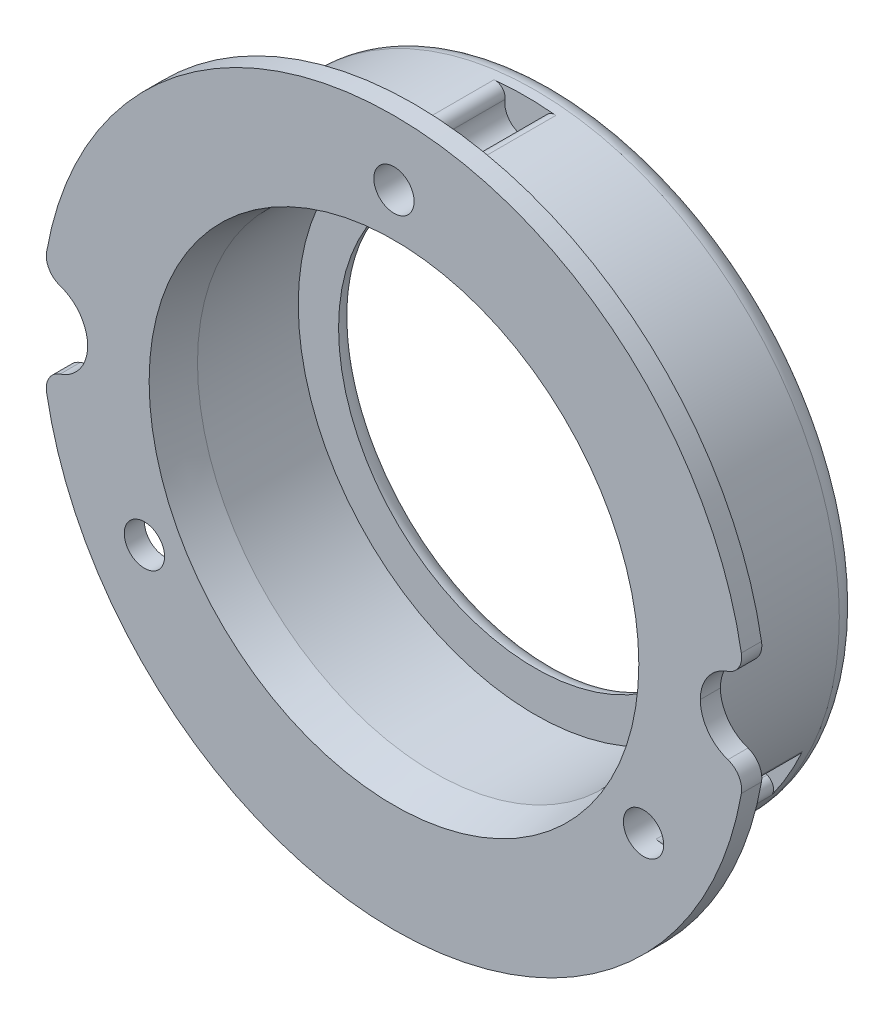
from build123d import *

# Parameters (mm, degrees)
SKETCH_1_R               = 15.1
SKETCH_1_R_2             = 11.750000000000002
EXTRUDE_1_DEPTH          = 3.5
SKETCH_2_R               = 11.750000000000004
SKETCH_2_R_2             = 9.750000000000002
EXTRUDE_2_DEPTH          = 1
FILLET_1_R               = 1
FILLET_2_R               = 1
SKETCH_3_R               = 17.500000000000004
SKETCH_3_R_2             = 11.750000000000002
EXTRUDE_3_DEPTH          = 1
CUT_EXTRUDE_1_DEPTH      = 26.719642299223374
FILLET_3_R               = 2
FILLET_4_R               = 1
SKETCH_6_R               = 1.0000000000000007
CUT_EXTRUDE_2_DEPTH      = 6.5
PATTERN_CIRCULAR_2_COUNT = 3
FILLET_6_R               = 0.5
CHAMFER_1_SIZE           = 0.4
CHAMFER_1_SIZE2          = 2


# Some blends are built 0.0001 mm under size
with BuildPart() as part:
    # 草图1 → 凸台-拉伸1 (new, symmetric)
    with BuildSketch(Plane.XY):
        Circle(SKETCH_1_R)
        Circle(SKETCH_1_R_2, mode=Mode.SUBTRACT)
    extrude(amount=EXTRUDE_1_DEPTH, both=True)

    # 草图2 → 凸台-拉伸2 (add)
    with BuildSketch(Plane(origin=(0, 0, -3.5), x_dir=(-1, 0, 0), z_dir=(0, 0, -1))):
        Circle(SKETCH_2_R)
        Circle(SKETCH_2_R_2, mode=Mode.SUBTRACT)
    extrude(amount=-EXTRUDE_2_DEPTH)

    # 圆角1
    fillet_1_edges = [part.edges().sort_by_distance(p)[0] for p in [
        (-15.1, 1.85e-15, -3.5),
    ]]
    fillet(fillet_1_edges, radius=FILLET_1_R)

    # 圆角2
    fillet_2_edges = [part.edges().sort_by_distance(p)[0] for p in [
        (9.750000000000002, 1.19e-15, -3.5),
    ]]
    fillet(fillet_2_edges, radius=FILLET_2_R - 0.0001)  # a hair under: the kernel refuses the full size

    # 草图3 → 凸台-拉伸3 (add)
    with BuildSketch(Plane.XY.offset(3.5)):
        Circle(SKETCH_3_R)
        with Locations(Location((0, 0, 0), (0, 0, 180))):
            Circle(SKETCH_3_R_2, mode=Mode.SUBTRACT)
    extrude(amount=EXTRUDE_3_DEPTH)

    # 草图4 → 切除-拉伸1 (cut, through all)
    with BuildSketch(Plane(origin=(0, 0, 3.5), x_dir=(-1, 0, 0), z_dir=(0, 0, -1))):
        with BuildLine():
            Line((-20.056660766424834, 2), (-15.06784656146989, 2))
            ThreePointArc((-15.06784656146989, 2), (-15.2, 1.86e-15), (-15.06784656146989, -2))
            Line((-15.06784656146989, -2), (-20.056660766424834, -2))
            Line((-20.056660766424834, -2), (-20.056660766424834, 2))
        make_face()
    cut_extrude_1 = extrude(amount=-CUT_EXTRUDE_1_DEPTH, mode=Mode.SUBTRACT)

    # 镜向1: 切除-拉伸1 across plane
    add(cut_extrude_1.mirror(Plane(origin=(0, 0, 0), x_dir=(0, 0, 1), z_dir=(1, 0, 0))), mode=Mode.SUBTRACT)

    # 圆角3
    fillet_3_edges = [part.edges().sort_by_distance(p)[0] for p in [
        (-15.067846561469892, -2, 4),
        (-15.067846561469892, 2, 4),
        (15.067846561469892, -2, 4),
        (15.067846561469892, 2, 4),
    ]]
    fillet(fillet_3_edges, radius=FILLET_3_R - 0.0001)  # a hair under: the kernel refuses the full size

    # 圆角4
    fillet_4_edges = [part.edges().sort_by_distance(p)[0] for p in [
        (17.385338650713713, 2, 4),
        (17.385338650713713, -2, 4),
        (-17.385338650713713, -2, 4),
        (-17.385338650713713, 2, 4),
    ]]
    fillet(fillet_4_edges, radius=FILLET_4_R)

    # 草图6 → 切除-拉伸2 (cut)
    with BuildSketch(Plane.XY.offset(4.500000000000001)):
        with Locations((7.1e-16, 14.299999999999999)):
            Circle(SKETCH_6_R)
    cut_extrude_2 = extrude(amount=-CUT_EXTRUDE_2_DEPTH, mode=Mode.SUBTRACT)

    # 阵列(圆周)2: 切除-拉伸2 ×3 about axis
    pattern_circular_2_axis = Axis((6.2e-16, -9.3e-16, 0), (0, 0, 1))
    for i in range(1, PATTERN_CIRCULAR_2_COUNT):
        add(cut_extrude_2.rotate(pattern_circular_2_axis, i * 360 / PATTERN_CIRCULAR_2_COUNT), mode=Mode.SUBTRACT)

    # 圆角6
    # the kernel refuses this fillet: 0.5 mm, written as the material it takes off along each edge
    with BuildSketch(Plane(origin=(-0.6164263274586522, 15.087412587412588, -1.9999999999999991), x_dir=(-0.9974594960272485, -0.0712359023601691, 0), z_dir=(0, 0, 1))) as fillet_6_piece_1:
        with BuildLine():
            CenterArc((0.9045816644890499, 0.49976803448578755), FILLET_6_R, 167.30835919933298, 104.43698518013807)
            ThreePointArc((0.41679836041578583, 0.6096199724175768), (0.2667346233621471, 0.2649259303036035), (0, 0))
            ThreePointArc((0, 0), (0.4599051560196865, -0.00700535852919151), (0.9198103120393711, 0))
        make_face()
    extrude(amount=5.499999999999999, mode=Mode.SUBTRACT)
    with BuildSketch(Plane(origin=(0.6164263274586537, 15.087412587412588, -1.9999999999999991), x_dir=(0.9974594960272485, -0.0712359023601691, 0), z_dir=(0, 0, 1))) as fillet_6_piece_2:
        with BuildLine():
            CenterArc((0.90458166448905, -0.49976803448578755), FILLET_6_R, 88.25465562052895, 104.43698518013832)
            ThreePointArc((0.41679836041578633, -0.6096199724175786), (0.266734623362148, -0.26492593030360523), (0, 0))
            ThreePointArc((0, 0), (0.45990515601968684, 0.00700535852919153), (0.9198103120393712, 0))
        make_face()
    extrude(amount=5.499999999999999, mode=Mode.SUBTRACT)
    with BuildSketch(Plane(origin=(13.374295741805769, -7.00986543456549, -1.9999999999999991), x_dir=(0.4370376469082089, 0.8994432139857056, 0), z_dir=(0, 0, 1))) as fillet_6_piece_3:
        with BuildLine():
            CenterArc((0.9045816644889654, 0.4997680344857882), FILLET_6_R, 167.30835919933284, 104.4369851801381)
            ThreePointArc((0.41679836041570123, 0.6096199724175785), (0.2667346233620795, 0.26492593030362477), (0, 0))
            ThreePointArc((0, 0), (0.45990515601963466, -0.00700535852919092), (0.9198103120392858, 0))
        make_face()
    extrude(amount=5.499999999999999, mode=Mode.SUBTRACT)
    with BuildSketch(Plane(origin=(12.757869414347034, -8.077547152847108, -1.9999999999999991), x_dir=(-0.5604218491190406, -0.8282073116255346, 0), z_dir=(0, 0, 1))) as fillet_6_piece_4:
        with BuildLine():
            CenterArc((0.9045816644889654, -0.49976803448578744), FILLET_6_R, 88.25465562052915, 104.43698518013807)
            ThreePointArc((0.4167983604157008, -0.6096199724175783), (0.26673462336207926, -0.264925930303624), (0, 0))
            ThreePointArc((0, 0), (0.4599051560196484, 0.00700535852919206), (0.9198103120392849, 3e-17))
        make_face()
    extrude(amount=5.499999999999999, mode=Mode.SUBTRACT)
    with BuildSketch(Plane(origin=(-12.757869414347084, -8.07754715284703, -1.9999999999999991), x_dir=(0.5604218491190395, -0.8282073116255352, 0), z_dir=(0, 0, 1))) as fillet_6_piece_5:
        with BuildLine():
            CenterArc((0.9045816644890518, 0.4997680344857874), FILLET_6_R, 167.30835919933295, 104.43698518013798)
            ThreePointArc((0.4167983604157886, 0.6096199724175766), (0.26673462336214776, 0.26492593030360556), (0, 0))
            ThreePointArc((0, 0), (0.4599051560196818, -0.00700535852919271), (0.9198103120393719, 3e-17))
        make_face()
    extrude(amount=5.499999999999999, mode=Mode.SUBTRACT)
    with BuildSketch(Plane(origin=(-13.374295741805737, -7.009865434565554, -1.9999999999999991), x_dir=(-0.43703764690820945, 0.8994432139857054, 0), z_dir=(0, 0, 1))) as fillet_6_piece_6:
        with BuildLine():
            CenterArc((0.9045816644890493, -0.4997680344857882), FILLET_6_R, 88.25465562052901, 104.43698518013812)
            ThreePointArc((0.4167983604157851, -0.6096199724175783), (0.2667346233621474, -0.26492593030360473), (0, 0))
            ThreePointArc((0, 0), (0.4599051560196919, 0.00700535852919249), (0.91981031203937, 2e-17))
        make_face()
    extrude(amount=5.499999999999999, mode=Mode.SUBTRACT)

    # 倒角1
    chamfer_1_edges = [part.edges().sort_by_distance(p)[0] for p in [
        (11.750000000000002, -8.1e-15, 4.5),
    ]]
    chamfer_1_side = [part.faces().sort_by_distance(p)[0] for p in [
        (15.179125181594527, 1.457318687256729, 4.5),
    ]]
    chamfer(chamfer_1_edges, length=CHAMFER_1_SIZE, length2=CHAMFER_1_SIZE2, reference=chamfer_1_side[0])


solid = part.part
